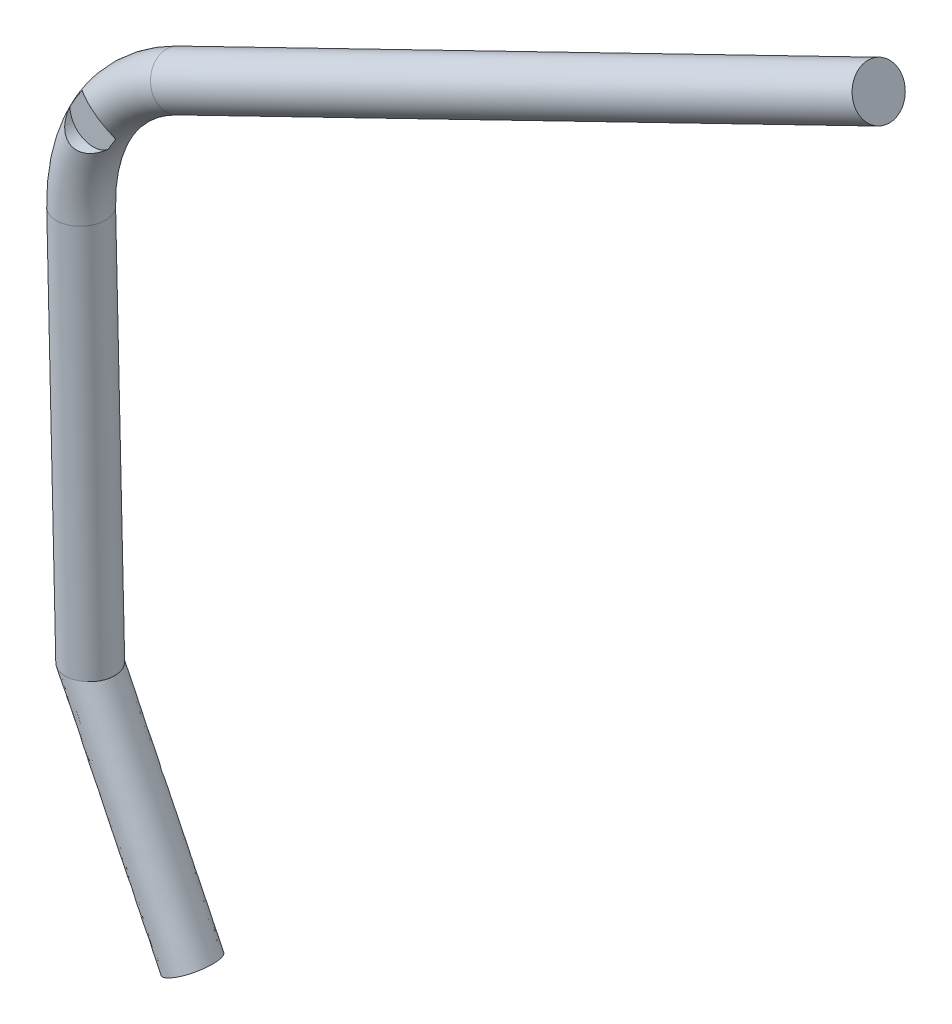
from build123d import *

# Parameters (mm, degrees)
SKETCH5_R               = 12.7
SKETCH6_R               = 12.7
BOSS_EXTRUDE3_DEPTH     = 406.4
SKETCH7_R               = 12.7
BOSS_EXTRUDE4_DEPTH     = 203.2
SKETCH8_R               = 12.065
CUT_EXTRUDE1_DEPTH      = 6.35
SKETCH9_R               = 12.7
CUT_EXTRUDE2_DEPTH      = 462.222817168
CUT_EXTRUDE2_DEPTH_BACK = 462.222817168


with BuildPart() as part:
    # Sweep1: sweep along a path in Sketch4
    with BuildLine(Plane.XY) as sweep1_path:
        ThreePointArc((-38.874671546, 79.949796199), (-75.907697444, 46.273442371), (-88.87582946, -2.072905643))
    # Sketch5 → Sweep1 (sweep)
    with BuildSketch(Plane(origin=(0, 0, 0), x_dir=(1, 0, 0), z_dir=(0, 1, 0))):
        with Locations((-88.87582946, 0)):
            Circle(SKETCH5_R)
    sweep(path=sweep1_path.line)

    # Sketch6 → Boss-Extrude3 (add)
    with BuildSketch(Plane(origin=(0, 0, 0), x_dir=(0, 0, -1), z_dir=(0.8993227918843839, 0.43728539421901275, 0))):
        with Locations((0, 88.87582946)):
            Circle(SKETCH6_R)
    extrude(amount=BOSS_EXTRUDE3_DEPTH)

    # Sketch7 → Boss-Extrude4 (add)
    with BuildSketch(Plane(origin=(0, 0, 0), x_dir=(-0.9997281154099812, -0.023317273828803834, 0), z_dir=(0.023317273828803834, -0.9997281154099812, 0))):
        with Locations((88.87582946, 0)):
            Circle(SKETCH7_R)
    extrude(amount=BOSS_EXTRUDE4_DEPTH)

    # Sketch8 → Cut-Extrude1 (cut)
    with BuildSketch(Plane.XY.offset(12.7)):
        with Locations((-76.269889492, 46.494235168)):
            Circle(SKETCH8_R)
    extrude(amount=-CUT_EXTRUDE1_DEPTH, mode=Mode.SUBTRACT)

    # Sweep2: sweep along a path in Sketch11
    with BuildLine(Plane.XY) as sweep2_path:
        Line((-84.113595449, -205.217095104), (-28.578350384, -319.431089673))
    # Sketch9 → Sweep2 (sweep)
    with BuildSketch(Plane(origin=(4.738070042, -203.144753051, 0), x_dir=(-0.9997281154099812, -0.023317273828803834, 0), z_dir=(0.023317273828803834, -0.9997281154099812, 0))):
        with Locations((88.87582946, 0)):
            Circle(SKETCH9_R)
    sweep(path=sweep2_path.line)

    # Sketch16 → Cut-Extrude2 (cut, two sides: drawn at the far end of the back side and taken through both)
    with BuildSketch(Plane.XY.offset(-CUT_EXTRUDE2_DEPTH_BACK)):
        Polygon((-41.274897449, -319.727219051), (-20.504520989, -309.627861689), (-15.881803318, -319.134960295), align=None)
    extrude(amount=CUT_EXTRUDE2_DEPTH + CUT_EXTRUDE2_DEPTH_BACK, mode=Mode.SUBTRACT)


solid = part.part
